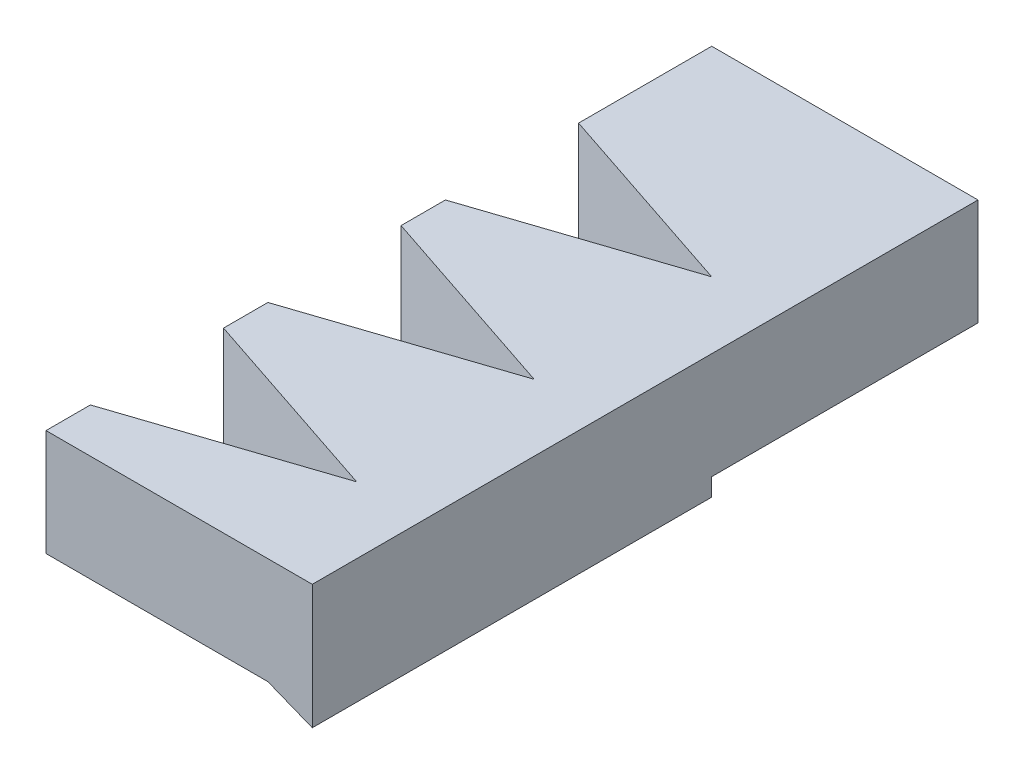
from build123d import *

# Parameters (mm, degrees)
SKETCH1_W           = 30
SKETCH1_H           = 75
BOSS_EXTRUDE1_DEPTH = 12
CUT_EXTRUDE1_DEPTH  = 12
LPATTERN1_COUNT     = 3
LPATTERN1_PITCH     = 20
BOUNDARY1_START     = -45
BOUNDARY1_DEPTH     = 5
LPATTERN2_COUNT     = 9
LPATTERN2_PITCH     = 5


# Read off the part's stored shape, not the designer's step: Boundary1
with BuildPart() as part:
    # Sketch1 → Boss-Extrude1 (new body)
    with BuildSketch(Plane(origin=(0, 0, 0), x_dir=(1, 0, 0), z_dir=(0, 1, 0))):
        with Locations((15, 37.5)):
            Rectangle(SKETCH1_W, SKETCH1_H)
    extrude(amount=BOSS_EXTRUDE1_DEPTH)

    # Sketch3 → Cut-Extrude1 (cut)
    with BuildSketch(Plane(origin=(0, 0, 0), x_dir=(1, 0, 0), z_dir=(0, 1, 0))):
        Polygon((0, 5), (22.5, 12.5), (0, 20), align=None)
    cut_extrude1 = extrude(amount=CUT_EXTRUDE1_DEPTH, mode=Mode.SUBTRACT)

    # LPattern1: Cut-Extrude1 ×3
    with Locations(*[(0, 0, -i * LPATTERN1_PITCH) for i in range(1, LPATTERN1_COUNT)]):
        add(cut_extrude1, mode=Mode.SUBTRACT)

    # Boundary1 outline → Boundary1 (add)
    with BuildSketch(Plane.XY.offset(BOUNDARY1_START)):
        Polygon((30, 0), (25, 0), (30, -2), align=None)
    boundary1 = extrude(amount=BOUNDARY1_DEPTH)

    # LPattern2: Boundary1 ×9
    with Locations(*[(0, 0, i * LPATTERN2_PITCH) for i in range(1, LPATTERN2_COUNT)]):
        add(boundary1)


solid = part.part
